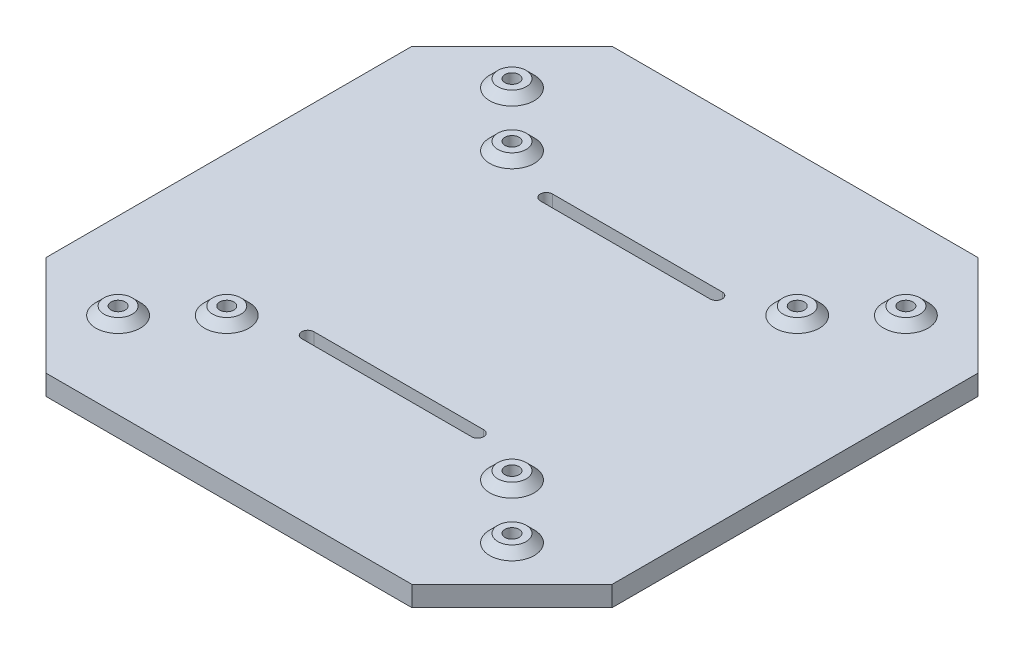
from build123d import *

# Parameters (mm, degrees)
SCHIZZO1_W                   = 140
SCHIZZO1_H                   = 140
ESTRUSIONE_ESTRUSIONE1_DEPTH = 5
TAGLIO_ESTRUSIONE1_DEPTH     = 159.140950013
TAGLIO_ESTRUSIONE2_DEPTH     = 159.140950013
SCHIZZO4_R                   = 5.5
ESTRUSIONE_ESTRUSIONE2_DEPTH = 2
SMUSSO1_SIZE                 = 2
SCHIZZO5_R                   = 1.75
TAGLIO_ESTRUSIONE3_DEPTH     = 159.21681349


with BuildPart() as part:
    # Schizzo1 → Estrusione-Estrusione1 (new body)
    with BuildSketch(Plane(origin=(0, 0, 0), x_dir=(1, 0, 0), z_dir=(0, 1, 0))):
        with Locations((44.091480444, -39.392386211)):
            Rectangle(SCHIZZO1_W, SCHIZZO1_H)
    extrude(amount=ESTRUSIONE_ESTRUSIONE1_DEPTH)

    # Schizzo2 → Taglio-Estrusione1 (cut, through all)
    with BuildSketch(Plane(origin=(0, 5, 0), x_dir=(1, 0, 0), z_dir=(0, 1, 0))):
        Polygon((-1.159782214, 30.607613789), (-25.908519556, 5.858876448), (-25.908519556, 30.607613789), align=None)
        Polygon((114.091480444, 5.858876448), (89.342743103, 30.607613789), (114.091480444, 30.607613789), align=None)
        Polygon((89.342743103, -109.392386211), (114.091480444, -84.643648869), (114.091480444, -109.392386211), align=None)
        Polygon((-25.908519556, -84.643648869), (-1.159782214, -109.392386211), (-25.908519556, -109.392386211), align=None)
    extrude(amount=-TAGLIO_ESTRUSIONE1_DEPTH, mode=Mode.SUBTRACT)

    # Schizzo3 → Taglio-Estrusione2 (cut, through all)
    with BuildSketch(Plane(origin=(0, 5, 0), x_dir=(1, 0, 0), z_dir=(0, 1, 0))):
        with BuildLine():
            Line((64.984963173, -67.392386211), (23.091480444, -67.392386211))
            ThreePointArc((23.091480444, -67.392386211), (21.591480444, -68.892386211), (23.091480444, -70.392386211))
            Line((23.091480444, -70.392386211), (64.984963173, -70.392386211))
            ThreePointArc((64.984963173, -70.392386211), (66.595257665, -68.892386211), (64.984963173, -67.392386211))
        make_face()
        with BuildLine():
            Line((65.091480444, -8.392386211), (23.091480444, -8.392386211))
            ThreePointArc((23.091480444, -8.392386211), (21.591480444, -9.892386211), (23.091480444, -11.392386211))
            Line((23.091480444, -11.392386211), (65.091480444, -11.392386211))
            ThreePointArc((65.091480444, -11.392386211), (66.591480444, -9.892386211), (65.091480444, -8.392386211))
        make_face()
    extrude(amount=-TAGLIO_ESTRUSIONE2_DEPTH, mode=Mode.SUBTRACT)

    # Schizzo4 → Estrusione-Estrusione2 (add)
    with BuildSketch(Plane(origin=(0, 5, 0), x_dir=(1, 0, 0), z_dir=(0, 1, 0))):
        with Locations(Location((-4.617054872, -88.100921527, 0), (0, 0, 270))):
            Circle(SCHIZZO4_R)
        with Locations(Location((8.817973971, -74.665892685, 0), (0, 0, 270))):
            Circle(SCHIZZO4_R)
        with Locations(Location((-4.617054872, 9.316149105, 0), (0, 0, 270))):
            Circle(SCHIZZO4_R)
        with Locations(Location((8.817973971, -4.118879737, 0), (0, 0, 270))):
            Circle(SCHIZZO4_R)
        with Locations(Location((92.80001576, 9.316149105, 0), (0, 0, 270))):
            Circle(SCHIZZO4_R)
        with Locations(Location((79.364986918, -4.118879737, 0), (0, 0, 270))):
            Circle(SCHIZZO4_R)
        with Locations(Location((92.80001576, -88.100921527, 0), (0, 0, 270))):
            Circle(SCHIZZO4_R)
        with Locations(Location((79.364986918, -74.665892685, 0), (0, 0, 270))):
            Circle(SCHIZZO4_R)
    extrude(amount=ESTRUSIONE_ESTRUSIONE2_DEPTH)

    # Smusso1
    smusso1_edges = [part.edges().sort_by_distance(p)[0] for p in [
        (92.80001576, 7, -14.816149105),
        (79.364986918, 7, -1.381120263),
        (92.80001576, 7, 82.600921527),
        (79.364986918, 7, 69.165892685),
        (-4.617054872, 7, 82.600921527),
        (8.817973971, 7, 69.165892685),
        (-4.617054872, 7, -14.816149105),
        (8.817973971, 7, -1.381120263),
    ]]
    chamfer(smusso1_edges, length=SMUSSO1_SIZE - 0.0001)  # a hair under: the kernel refuses the full size

    # Schizzo5 → Taglio-Estrusione3 (cut, through all)
    with BuildSketch(Plane(origin=(0, 7, 0), x_dir=(1, 0, 0), z_dir=(0, 1, 0))):
        with Locations(Location((-4.617054872, -88.100921527, 0), (0, 0, 270))):
            Circle(SCHIZZO5_R)
        with Locations(Location((8.817973971, -74.665892685, 0), (0, 0, 270))):
            Circle(SCHIZZO5_R)
        with Locations(Location((-4.617054872, 9.316149105, 0), (0, 0, 270))):
            Circle(SCHIZZO5_R)
        with Locations(Location((8.817973971, -4.118879737, 0), (0, 0, 270))):
            Circle(SCHIZZO5_R)
        with Locations(Location((92.80001576, 9.316149105, 0), (0, 0, 270))):
            Circle(SCHIZZO5_R)
        with Locations(Location((79.364986918, -4.118879737, 0), (0, 0, 270))):
            Circle(SCHIZZO5_R)
        with Locations(Location((92.80001576, -88.100921527, 0), (0, 0, 270))):
            Circle(SCHIZZO5_R)
        with Locations(Location((79.364986918, -74.665892685, 0), (0, 0, 270))):
            Circle(SCHIZZO5_R)
    extrude(amount=-TAGLIO_ESTRUSIONE3_DEPTH, mode=Mode.SUBTRACT)


solid = part.part
